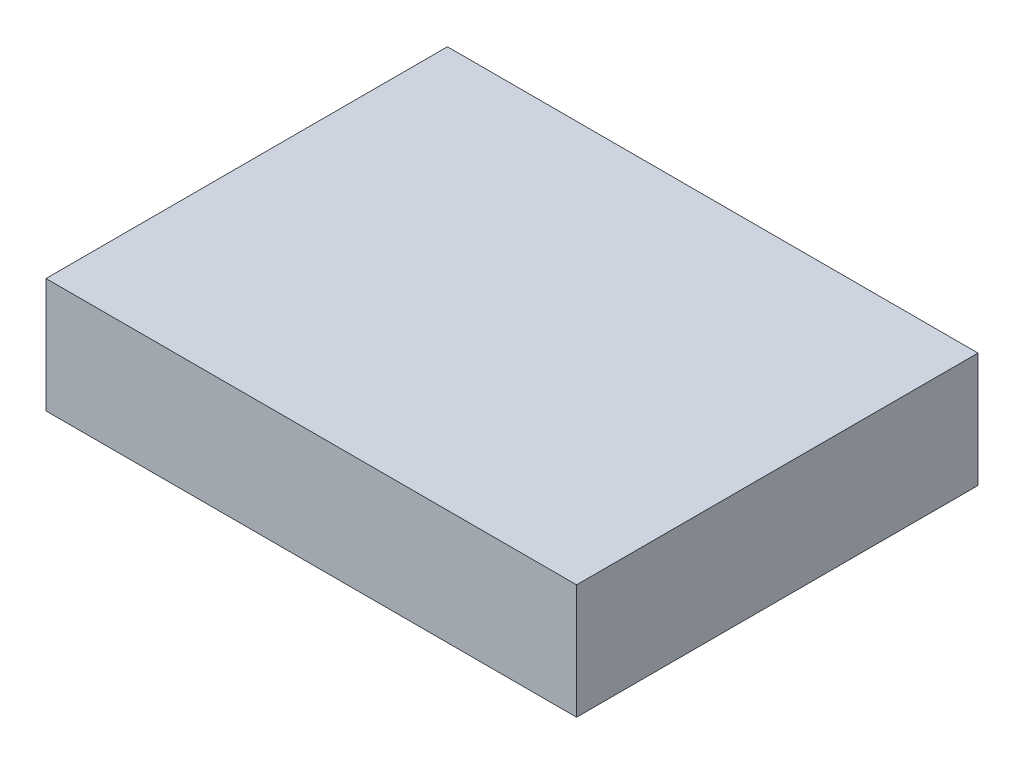
from build123d import *

# Parameters (mm, degrees)
SKETCH1_W           = 47
SKETCH1_H           = 35.56
BOSS_EXTRUDE1_DEPTH = 10.16


with BuildPart() as part:
    # Sketch1 → Boss-Extrude1 (new body)
    with BuildSketch(Plane(origin=(0, 0, 0), x_dir=(1, 0, 0), z_dir=(0, 1, 0))):
        Rectangle(SKETCH1_W, SKETCH1_H)
    extrude(amount=BOSS_EXTRUDE1_DEPTH)


solid = part.part
